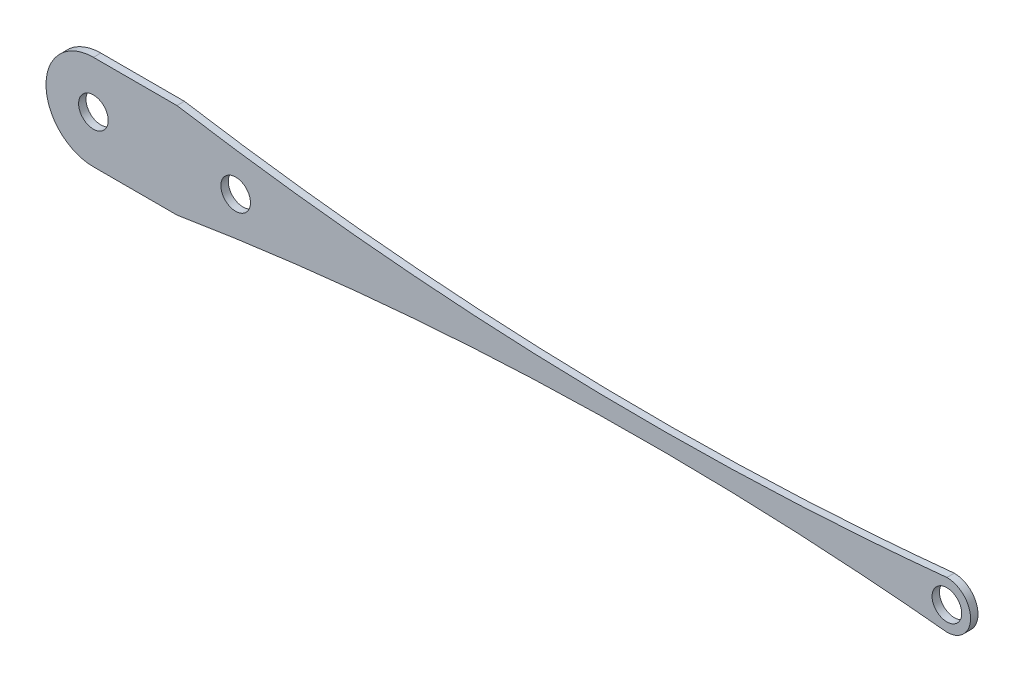
from build123d import *

# Parameters (mm, degrees)
SKETCH4_R           = 7.9375
BOSS_EXTRUDE2_DEPTH = 3.96875
SCALE1_SCALE        = 0.75


with BuildPart() as part:
    # Sketch4 → Boss-Extrude2 (new body)
    with BuildSketch(Plane.XY):
        with BuildLine():
            Line((44.742290553, 25.4), (0, 25.4))
            ThreePointArc((0, 25.4), (-25.4, 0), (0, -25.4))
            Line((0, -25.4), (44.742290553, -25.4))
            add(Edge.make_bspline(
                [(44.742290553, -25.4), (48.709211627, -24.754322793), (52.676896009, -24.128863136)],
                knots=[0, 0, 0, 0.019331262, 0.019331262, 0.019331262], degree=2))
            add(Edge.make_bspline(
                [(52.676896009, -24.128863136), (253.95626011, 7.600505915), (457.2, -12.7)],
                knots=[0.019331262, 0.019331262, 0.019331262, 1, 1, 1], degree=2))
            ThreePointArc((457.2, -12.7), (469.9, 0), (457.2, 12.7))
            add(Edge.make_bspline(
                [(52.676896009, 24.128863136), (253.95626011, -7.600505915), (457.2, 12.7)],
                knots=[0.019331262, 0.019331262, 0.019331262, 1, 1, 1], degree=2))
            add(Edge.make_bspline(
                [(44.742290553, 25.4), (48.709211627, 24.754322793), (52.676896009, 24.128863136)],
                knots=[0, 0, 0, 0.019331262, 0.019331262, 0.019331262], degree=2))
        make_face()
        Circle(SKETCH4_R, mode=Mode.SUBTRACT)
        with Locations((76.2, 0)):
            Circle(SKETCH4_R, mode=Mode.SUBTRACT)
        with Locations((457.2, 0)):
            Circle(SKETCH4_R, mode=Mode.SUBTRACT)
    extrude(amount=BOSS_EXTRUDE2_DEPTH)


with BuildPart() as part_1:
    # Scale1: scaled about (157.660684288, 0, 1.984375)
    add(part.part.scale(SCALE1_SCALE).moved(Location((39.415171072, 0, 0.49609375))))


solid = part_1.part
